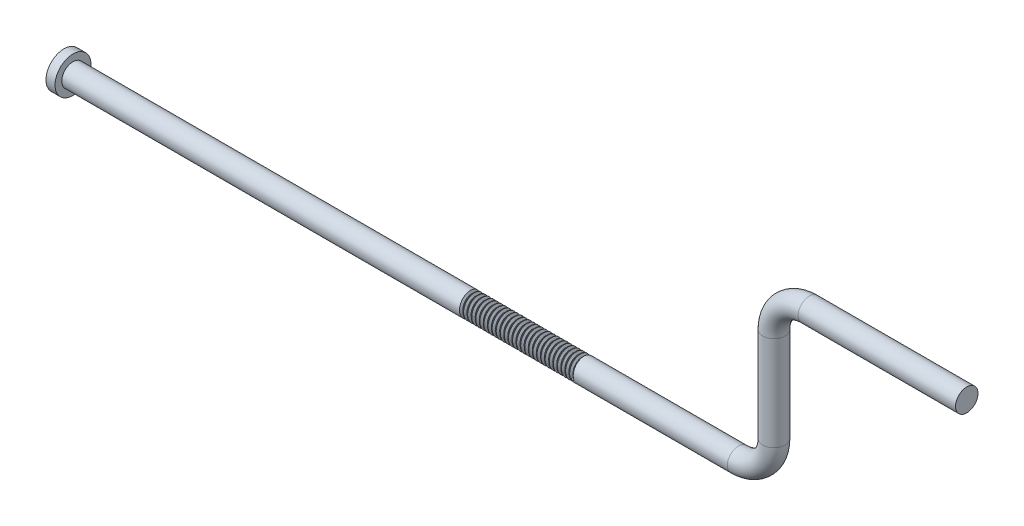
from build123d import *

# Parameters (mm, degrees)
SKETCH3_R           = 2.5
THREAD2_PITCH       = 0.907142857
SKETCH17_R          = 2.5
BOSS_EXTRUDE1_DEPTH = 90
SKETCH20_R          = 4
BOSS_EXTRUDE2_DEPTH = 2


with BuildPart() as part:
    # Sweep1: sweep along a path in Sketch1
    with BuildLine(Plane.XY) as sweep1_path:
        Line((-35.563195439, 0), (24.436804561, 0))
        ThreePointArc((24.436804561, 0), (30.004211849, 2.306095606), (32.310307454, 7.873502893))
        Line((32.310307454, 7.873502893), (32.310307454, 28.873502893))
        ThreePointArc((32.310307454, 28.873502893), (34.61640306, 34.44091018), (40.183810347, 36.747005786))
        Line((40.183810347, 36.747005786), (75.183810347, 36.747005786))
    # Sketch3 → Sweep1 (sweep)
    with BuildSketch(Plane(origin=(-35.563195439, 0, 0), x_dir=(0, 0, -1), z_dir=(1, 0, 0))):
        Circle(SKETCH3_R)
    sweep(path=sweep1_path.line)

    # Thread2: the profile of Thread Profile2 profile screwed along a right-hand helix of 27.559055 turns, 8 arcs to a turn; built about Z, then put on its axis
    thread2_z = Axis((0, 0, 0), (0, 0, 1))
    thread2_corners = [(2.5003, 0, -0.000173205), (2.5003, 0, 0.793923203), (2.008994528, 0, 0.510267856), (2.008994528, 0, 0.283482142)]
    with BuildLine(mode=Mode.PRIVATE) as thread2_profile:
        Line(thread2_corners[0], thread2_corners[1])
        Line(thread2_corners[1], thread2_corners[2])
        Line(thread2_corners[2], thread2_corners[3])
        Line(thread2_corners[3], thread2_corners[0])
    thread2_cap = Face(thread2_profile.wire())
    thread2_turn_angles = [0, 22.5, 45, 67.5, 90, 112.5, 135, 157.5, 180, 202.5, 225, 247.5, 270, 292.5, 315, 337.5, 360]
    thread2_turn_weights = [1, 0.9238795325112867, 1, 0.9238795325112867, 1, 0.9238795325112867, 1, 0.9238795325112867, 1, 0.9238795325112867, 1, 0.9238795325112867, 1, 0.9238795325112867, 1, 0.9238795325112867, 1]
    thread2_turn_rails = [Edge.make_bspline([Vector(p[0], p[1], 0).rotate(thread2_z, thread2_turn_angles[k]) / thread2_turn_weights[k] + Vector(0, 0, p[2] + THREAD2_PITCH * thread2_turn_angles[k] / 360) for k in range(17)], [0, 0, 0, 1, 1, 2, 2, 3, 3, 4, 4, 5, 5, 6, 6, 7, 7, 8, 8, 8], 2, thread2_turn_weights) for p in thread2_corners]
    thread2_turn_sides = [Face.make_surface_from_curves(thread2_turn_rails[p[0]], thread2_turn_rails[p[1]]) for p in [(0, 1), (1, 2), (2, 3), (3, 0)]]
    thread2_last_angles = [9720, 9742.5, 9765, 9787.5, 9810, 9832.5, 9855, 9877.5, 9900, 9910.62992126, 9921.25984252]
    thread2_last_weights = [1, 0.9238795325112867, 1, 0.9238795325112867, 1, 0.9238795325112867, 1, 0.9238795325112867, 1, 0.9828391512194212, 1]
    thread2_last_rails = [Edge.make_bspline([Vector(p[0], p[1], 0).rotate(thread2_z, thread2_last_angles[k]) / thread2_last_weights[k] + Vector(0, 0, p[2] + THREAD2_PITCH * thread2_last_angles[k] / 360) for k in range(11)], [0, 0, 0, 1, 1, 2, 2, 3, 3, 4, 4, 5, 5, 5], 2, thread2_last_weights) for p in thread2_corners]
    thread2_last_sides = [Face.make_surface_from_curves(thread2_last_rails[p[0]], thread2_last_rails[p[1]]) for p in [(0, 1), (1, 2), (2, 3), (3, 0)]]
    thread2 = Plane(origin=(-35.563195439, 0, 0), x_dir=(0, 0, -1), z_dir=(1, 0, 0)) * Solid(Shell([*[p.moved(Location((0, 0, THREAD2_PITCH * i))) for i in range(27) for p in thread2_turn_sides], *thread2_last_sides, thread2_cap, thread2_cap.rotate(thread2_z, 9921.25984252).moved(Location((0, 0, THREAD2_PITCH * 9921.25984252 / 360)))]))
    add(thread2, mode=Mode.SUBTRACT)

    # Sketch17 → Boss-Extrude1 (add)
    with BuildSketch(Plane(origin=(-35.563195439, 0, 0), x_dir=(0, 0, -1), z_dir=(1, 0, 0))):
        Circle(SKETCH17_R)
    extrude(amount=-BOSS_EXTRUDE1_DEPTH)

    # Sketch20 → Boss-Extrude2 (add)
    with BuildSketch(Plane.ZY.offset(125.563195439)):
        Circle(SKETCH20_R)
    extrude(amount=-BOSS_EXTRUDE2_DEPTH)


solid = part.part
